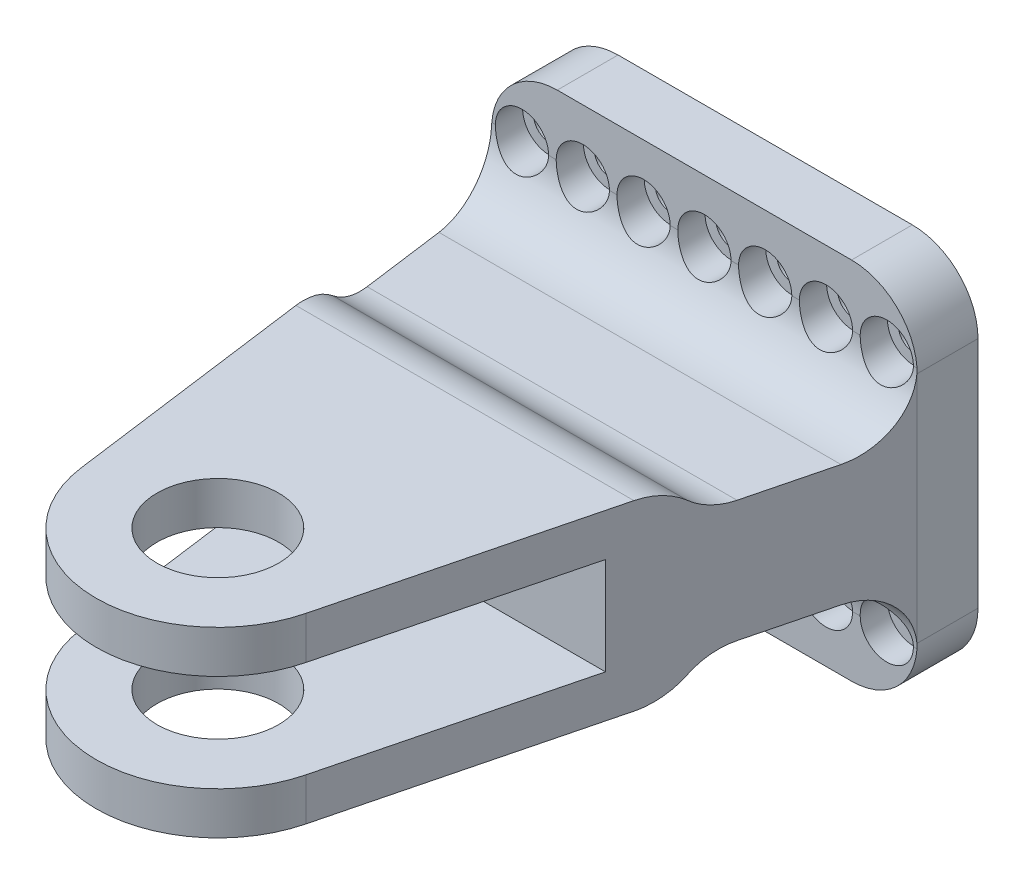
from build123d import *

# Parameters (mm, degrees)
SKETCH1_W                                      = 44.45
SKETCH1_H                                      = 38.1
BOSS_EXTRUDE1_DEPTH                            = 6.35
CBORE_FOR_4_SOCKET_HEAD_CAP_SCREW1_D           = 3.2639
CBORE_FOR_4_SOCKET_HEAD_CAP_SCREW1_CBORE_D     = 5.55752
CBORE_FOR_4_SOCKET_HEAD_CAP_SCREW1_CBORE_DEPTH = 2.8448
SKETCH4_R                                      = 6.35
BOSS_EXTRUDE2_DEPTH                            = 6.35
SKETCH5_R                                      = 6.35
BOSS_EXTRUDE3_DEPTH                            = 9.525
CUT_EXTRUDE1_DEPTH                             = 5.08
FILLET3_R                                      = 6.35
FILLET2_R                                      = 6.858


with BuildPart() as part:
    # Sketch1 → Boss-Extrude1 (new body)
    with BuildSketch(Plane.XY):
        Rectangle(SKETCH1_W, SKETCH1_H)
    extrude(amount=BOSS_EXTRUDE1_DEPTH)

    # CBORE for #4 Socket Head Cap Screw1 (through all)
    with Locations(Plane.XY.offset(6.35)):
        with Locations((-19.05, 12.7), (19.05, -12.7), (-19.05, -12.7), (19.05, 12.7), (12.7, -12.7), (12.7, 12.7), (6.35, -12.7), (6.35, 12.7), (0, -12.7), (0, 12.7), (-6.35, -12.7), (-6.35, 12.7), (-12.7, -12.7), (-12.7, 12.7)):
            CounterBoreHole(CBORE_FOR_4_SOCKET_HEAD_CAP_SCREW1_D / 2, CBORE_FOR_4_SOCKET_HEAD_CAP_SCREW1_CBORE_D / 2, CBORE_FOR_4_SOCKET_HEAD_CAP_SCREW1_CBORE_DEPTH)

    # Sketch4 → Boss-Extrude2 (add, symmetric)
    with BuildSketch(Plane(origin=(0, 0, 0), x_dir=(1, 0, 0), z_dir=(0, 1, 0))):
        with BuildLine():
            Line((-15.587362539, -55.855691785), (-22.225, -6.35))
            Line((-22.225, -6.35), (22.225, -6.35))
            Line((22.225, -6.35), (9.310522869, -57.289061907))
            ThreePointArc((9.310522869, -57.289061907), (-3.729929785, -66.847006367), (-15.587362539, -55.855691785))
        make_face()
        with Locations(Location((-2.99999997, -54.168, 0), (0, 0, 270))):
            Circle(SKETCH4_R, mode=Mode.SUBTRACT)
    extrude(amount=BOSS_EXTRUDE2_DEPTH, both=True)

    # Sketch5 → Boss-Extrude3 (add, symmetric)
    with BuildSketch(Plane(origin=(0, 0, 0), x_dir=(1, 0, 0), z_dir=(0, 1, 0))):
        with BuildLine():
            Line((17.024380682, -26.863), (-19.474652468, -26.863))
            Line((-19.474652468, -26.863), (-15.587362539, -55.855691785))
            ThreePointArc((-15.587362539, -55.855691785), (-3.729929785, -66.847006367), (9.310522869, -57.289061907))
            Line((9.310522869, -57.289061907), (17.024380682, -26.863))
        make_face()
        with Locations(Location((-2.99999997, -54.168, 0), (0, 0, 270))):
            Circle(SKETCH5_R, mode=Mode.SUBTRACT)
    extrude(amount=BOSS_EXTRUDE3_DEPTH, both=True)

    # Sketch6 → Cut-Extrude1 (cut, symmetric)
    with BuildSketch(Plane(origin=(0, 0, 0), x_dir=(1, 0, 0), z_dir=(0, 1, 0))):
        with BuildLine():
            Line((-18.74245104, -32.324), (15.63986442, -32.324))
            Line((15.63986442, -32.324), (9.310522869, -57.289061907))
            ThreePointArc((9.310522869, -57.289061907), (-3.729929785, -66.847006367), (-15.587362539, -55.855691785))
            Line((-15.587362539, -55.855691785), (-18.74245104, -32.324))
        make_face()
    extrude(amount=CUT_EXTRUDE1_DEPTH, both=True, mode=Mode.SUBTRACT)

    # Fillet3
    # the kernel refuses this fillet: 6.35 mm, written as the material it adds along each edge
    with BuildSketch(Plane(origin=(-38.1, 6.35, 6.35), x_dir=(0, 1, 0), z_dir=(1, 0, 0))) as fillet3_piece_1_section:
        with BuildLine():
            CenterArc((FILLET3_R, FILLET3_R), FILLET3_R, 180, 90)
            Line((0, FILLET3_R), (0, 0))
            Line((0, 0), (FILLET3_R, 0))
        make_face()
    fillet3_piece_1 = extrude(amount=76.2, mode=Mode.PRIVATE)
    fillet3_piece_1 = split(fillet3_piece_1, bisect_by=Plane(origin=(-22.505344839, 6.35, 4.25909563), z_dir=(0.9911309109329518, 0, -0.1328891169103669)), keep=Keep.TOP, mode=Mode.PRIVATE)
    fillet3_piece_1 = split(fillet3_piece_1, bisect_by=Plane(origin=(18.581702341, 6.35, 20.720397122), z_dir=(-0.9693325070257208, 0, -0.24575290603211808)), keep=Keep.TOP, mode=Mode.PRIVATE)
    fillet3_piece_1 = fillet3_piece_1 - Plane(origin=(-19.05, 12.7, 6.35), x_dir=(1, 0, 0), z_dir=(0, 0, 1)) * Cylinder(2.77876, 178, mode=Mode.PRIVATE)
    fillet3_piece_1 = fillet3_piece_1 - Plane(origin=(-12.7, 12.7, 6.35), x_dir=(1, 0, 0), z_dir=(0, 0, 1)) * Cylinder(2.77876, 178, mode=Mode.PRIVATE)
    fillet3_piece_1 = fillet3_piece_1 - Plane(origin=(-6.35, 12.7, 6.35), x_dir=(1, 0, 0), z_dir=(0, 0, 1)) * Cylinder(2.77876, 178, mode=Mode.PRIVATE)
    fillet3_piece_1 = fillet3_piece_1 - Plane(origin=(0, 12.7, 6.35), x_dir=(1, 0, 0), z_dir=(0, 0, 1)) * Cylinder(2.77876, 178, mode=Mode.PRIVATE)
    fillet3_piece_1 = fillet3_piece_1 - Plane(origin=(6.35, 12.7, 6.35), x_dir=(1, 0, 0), z_dir=(0, 0, 1)) * Cylinder(2.77876, 178, mode=Mode.PRIVATE)
    fillet3_piece_1 = fillet3_piece_1 - Plane(origin=(12.7, 12.7, 6.35), x_dir=(1, 0, 0), z_dir=(0, 0, 1)) * Cylinder(2.77876, 178, mode=Mode.PRIVATE)
    fillet3_piece_1 = fillet3_piece_1 - Plane(origin=(19.05, 12.7, 6.35), x_dir=(1, 0, 0), z_dir=(0, 0, 1)) * Cylinder(2.77876, 178, mode=Mode.PRIVATE)
    add(fillet3_piece_1)
    with BuildSketch(Plane(origin=(-38.1, -6.35, 6.35), x_dir=(0, -1, 0), z_dir=(1, 0, 0))) as fillet3_piece_2_section:
        with BuildLine():
            CenterArc((FILLET3_R, -FILLET3_R), FILLET3_R, 90, 90)
            Line((0, -FILLET3_R), (0, 0))
            Line((0, 0), (FILLET3_R, 0))
        make_face()
    fillet3_piece_2 = extrude(amount=76.2, mode=Mode.PRIVATE)
    fillet3_piece_2 = split(fillet3_piece_2, bisect_by=Plane(origin=(-22.505344839, -6.35, 4.25909563), z_dir=(0.9911309109329518, 0, -0.1328891169103669)), keep=Keep.TOP, mode=Mode.PRIVATE)
    fillet3_piece_2 = split(fillet3_piece_2, bisect_by=Plane(origin=(18.581702341, -6.35, 20.720397122), z_dir=(-0.9693325070257208, 0, -0.24575290603211808)), keep=Keep.TOP, mode=Mode.PRIVATE)
    fillet3_piece_2 = fillet3_piece_2 - Plane(origin=(-19.05, -12.7, 6.35), x_dir=(1, 0, 0), z_dir=(0, 0, 1)) * Cylinder(2.77876, 178, mode=Mode.PRIVATE)
    fillet3_piece_2 = fillet3_piece_2 - Plane(origin=(-12.7, -12.7, 6.35), x_dir=(1, 0, 0), z_dir=(0, 0, 1)) * Cylinder(2.77876, 178, mode=Mode.PRIVATE)
    fillet3_piece_2 = fillet3_piece_2 - Plane(origin=(-6.35, -12.7, 6.35), x_dir=(1, 0, 0), z_dir=(0, 0, 1)) * Cylinder(2.77876, 178, mode=Mode.PRIVATE)
    fillet3_piece_2 = fillet3_piece_2 - Plane(origin=(0, -12.7, 6.35), x_dir=(1, 0, 0), z_dir=(0, 0, 1)) * Cylinder(2.77876, 178, mode=Mode.PRIVATE)
    fillet3_piece_2 = fillet3_piece_2 - Plane(origin=(6.35, -12.7, 6.35), x_dir=(1, 0, 0), z_dir=(0, 0, 1)) * Cylinder(2.77876, 178, mode=Mode.PRIVATE)
    fillet3_piece_2 = fillet3_piece_2 - Plane(origin=(12.7, -12.7, 6.35), x_dir=(1, 0, 0), z_dir=(0, 0, 1)) * Cylinder(2.77876, 178, mode=Mode.PRIVATE)
    fillet3_piece_2 = fillet3_piece_2 - Plane(origin=(19.05, -12.7, 6.35), x_dir=(1, 0, 0), z_dir=(0, 0, 1)) * Cylinder(2.77876, 178, mode=Mode.PRIVATE)
    add(fillet3_piece_2)
    with BuildSketch(Plane(origin=(-33.222805753, -6.35, 26.863), x_dir=(0, 0, -1), z_dir=(1, 0, 0))) as fillet3_piece_3_section:
        with BuildLine():
            CenterArc((5.499261314, -6.35), FILLET3_R, 90, 60)
            Line((0, -3.175), (0, 0))
            Line((0, 0), (5.499261314, 0))
        make_face()
    fillet3_piece_3 = extrude(amount=63.99533972, mode=Mode.PRIVATE)
    fillet3_piece_3 = split(fillet3_piece_3, bisect_by=Plane(origin=(-19.71743822, -6.35, 25.052223699), z_dir=(0.9911309109329518, 0, -0.1328891169103669)), keep=Keep.TOP, mode=Mode.PRIVATE)
    fillet3_piece_3 = split(fillet3_piece_3, bisect_by=Plane(origin=(13.989727442, -6.35, 38.832697859), z_dir=(-0.9693325070257208, 0, -0.24575290603211808)), keep=Keep.TOP, mode=Mode.PRIVATE)
    add(fillet3_piece_3)
    with BuildSketch(Plane(origin=(-33.222805753, 6.35, 26.863), x_dir=(0, 0, -1), z_dir=(1, 0, 0))) as fillet3_piece_4_section:
        with BuildLine():
            CenterArc((5.499261314, 6.35), FILLET3_R, 210, 60)
            Line((0, 3.175), (0, 0))
            Line((0, 0), (5.499261314, 0))
        make_face()
    fillet3_piece_4 = extrude(amount=63.99533972, mode=Mode.PRIVATE)
    fillet3_piece_4 = split(fillet3_piece_4, bisect_by=Plane(origin=(-19.71743822, 6.35, 25.052223699), z_dir=(0.9911309109329518, 0, -0.1328891169103669)), keep=Keep.TOP, mode=Mode.PRIVATE)
    fillet3_piece_4 = split(fillet3_piece_4, bisect_by=Plane(origin=(13.989727442, 6.35, 38.832697859), z_dir=(-0.9693325070257208, 0, -0.24575290603211808)), keep=Keep.TOP, mode=Mode.PRIVATE)
    add(fillet3_piece_4)

    # Fillet2
    # the kernel refuses this fillet: 6.858 mm, written as the material it takes off along each edge
    with BuildSketch(Plane(origin=(-22.225, 19.05, -17.145), x_dir=(0, -1, 0), z_dir=(0, 0, 1)), Plane(origin=(22.225, -19.05, -17.145), x_dir=(0, 1, 0), z_dir=(0, 0, 1))) as fillet2_piece_1:
        with BuildLine():
            CenterArc((FILLET2_R, FILLET2_R), FILLET2_R, 180, 90)
            Line((0, FILLET2_R), (0, 0))
            Line((0, 0), (FILLET2_R, 0))
        make_face()
    extrude(amount=40.64, mode=Mode.SUBTRACT)
    with BuildSketch(Plane(origin=(-22.225, -19.05, -17.145), x_dir=(0, 1, 0), z_dir=(0, 0, 1)), Plane(origin=(22.225, 19.05, -17.145), x_dir=(0, -1, 0), z_dir=(0, 0, 1))) as fillet2_piece_2:
        with BuildLine():
            CenterArc((FILLET2_R, -FILLET2_R), FILLET2_R, 90, 90)
            Line((0, -FILLET2_R), (0, 0))
            Line((0, 0), (FILLET2_R, 0))
        make_face()
    extrude(amount=40.64, mode=Mode.SUBTRACT)
    with BuildSketch(Plane(origin=(24.751529345, 9.525, 26.863), x_dir=(0, -0.7692306113945376, -0.6389712563907594), z_dir=(-1, 0, 0))) as fillet2_piece_3:
        with BuildLine():
            CenterArc((3.300413177, 6.759648592), FILLET2_R, 219.715151385, 40.56969723)
            Line((-1.974970356, 2.377583716), (0, 0))
            ThreePointArc((0, 0), (1.07156272, 0.091066118), (2.14312544, 0))
        make_face()
    extrude(amount=51.953330475, mode=Mode.SUBTRACT)
    with BuildSketch(Plane(origin=(24.751529345, -9.525, 26.863), x_dir=(0, 0.7692306113945383, -0.6389712563907588), z_dir=(-1, 0, 0))) as fillet2_piece_4:
        with BuildLine():
            CenterArc((3.300413177, -6.759648592), FILLET2_R, 99.715151385, 40.56969723)
            Line((-1.974970356, -2.377583716), (0, 0))
            ThreePointArc((0, 0), (1.07156272, -0.091066118), (2.14312544, 0))
        make_face()
    extrude(amount=51.953330475, mode=Mode.SUBTRACT)


solid = part.part
